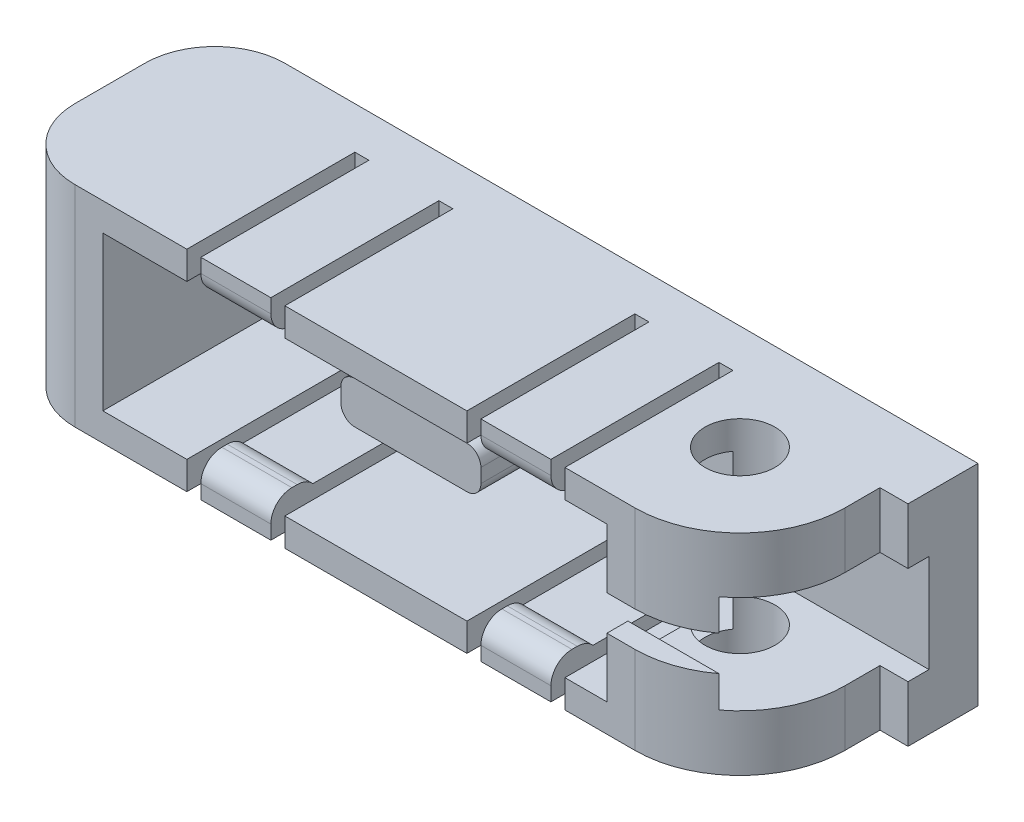
from build123d import *

# Parameters (mm, degrees)
SKETCH1_R             = 7.5
SKETCH1_R_2           = 2.5
SKETCH1_W             = 2
SKETCH1_H             = 5
BOSS_EXTRUDE1_DEPTH   = 7.5
CUT_EXTRUDE1_START    = 7.5
SKETCH2_W             = 36
SKETCH2_H             = 11
CUT_EXTRUDE1_DEPTH    = 12
SKETCH3_W             = 1.5
SKETCH3_H             = 2.5
SKETCH3_W_2           = 10
SKETCH3_H_2           = 7
CUT_EXTRUDE2_DEPTH    = 40
SKETCH5_W             = 1
SKETCH5_H             = 12
CUT_EXTRUDE3_DEPTH    = 20
BOSS_EXTRUDE2_START   = 14
SKETCH6_W             = 3
SKETCH6_H             = 0.5
BOSS_EXTRUDE2_DEPTH   = 5
FILLET2_R             = 1.5
LPATTERN4_START       = -12
LPATTERN4_OUTLINE_W   = 2
LPATTERN4_OUTLINE_H   = 12
LPATTERN4_DEPTH       = 1
LPATTERN4_START_2     = -6
LPATTERN4_2_OUTLINE_W = 2
LPATTERN4_2_OUTLINE_H = 12
LPATTERN4_2_DEPTH     = 1
LPATTERN4_START_3     = -11
LPATTERN4_3_DEPTH     = 5
LPATTERN4_4_DEPTH     = 5
BOSS_EXTRUDE3_START   = -4.5
BOSS_EXTRUDE3_DEPTH   = 8
SKETCH8_W             = 3
SKETCH8_H             = 4
CUT_EXTRUDE4_DEPTH    = 3


# Read off the part's stored shape, not the designer's step: LPattern4
with BuildPart() as part:
    # Sketch1 → Boss-Extrude1 (new, symmetric)
    # profile 1 of 4: a face of its own
    with BuildSketch(Plane(origin=(0, 0, 0), x_dir=(1, 0, 0), z_dir=(0, 1, 0))):
        with BuildLine():
            ThreePointArc((20, -7.5), (12.5, 0), (20, 7.5))
            Line((20, 7.5), (-20, 7.5))
            ThreePointArc((-20, 7.5), (-23.535533906, 6.035533906), (-25, 2.5))
            Line((-25, 2.5), (-25, -2.5))
            ThreePointArc((-25, -2.5), (-23.535533906, -6.035533906), (-20, -7.5))
            Line((-20, -7.5), (20, -7.5))
        make_face()
    # profile 2 of 4: a face of its own
    with BuildSketch(Plane(origin=(0, 0, 0), x_dir=(1, 0, 0), z_dir=(0, 1, 0))):
        with Locations((20, 0)):
            Circle(SKETCH1_R)
        with Locations(Location((20, 0, 0), (0, 0, 270))):
            Circle(SKETCH1_R_2, mode=Mode.SUBTRACT)
    # profile 3 of 4: a face of its own
    with BuildSketch(Plane(origin=(0, 0, 0), x_dir=(1, 0, 0), z_dir=(0, 1, 0))):
        with BuildLine():
            Line((27.5, 2.5), (27.5, 7.5))
            Line((27.5, 7.5), (20, 7.5))
            ThreePointArc((20, 7.5), (25.303300859, 5.303300859), (27.5, 0))
            Line((27.5, 0), (27.5, 2.5))
        make_face()
    # profile 4 of 4: a face of its own
    with BuildSketch(Plane(origin=(0, 0, 0), x_dir=(1, 0, 0), z_dir=(0, 1, 0))):
        with Locations((28.5, 5)):
            Rectangle(SKETCH1_W, SKETCH1_H)
    extrude(amount=BOSS_EXTRUDE1_DEPTH, both=True)

    # Sketch2 → Cut-Extrude1 (cut)
    with BuildSketch(Plane.XY.offset(CUT_EXTRUDE1_START)):
        Rectangle(SKETCH2_W, SKETCH2_H)
    extrude(amount=-CUT_EXTRUDE1_DEPTH, mode=Mode.SUBTRACT)

    # Sketch3 → Cut-Extrude2 (cut)
    with BuildSketch(Plane(origin=(0, 0, 0), x_dir=(0, 0, -1), z_dir=(1, 0, 0))):
        with Locations((-6.75, 0)):
            Rectangle(SKETCH3_W, SKETCH3_H)
        with Locations((-1, 0)):
            Rectangle(SKETCH3_W_2, SKETCH3_H_2)
    extrude(amount=CUT_EXTRUDE2_DEPTH, mode=Mode.SUBTRACT)

    # Sketch5 → Cut-Extrude3 (cut, symmetric)
    with BuildSketch(Plane(origin=(0, 0, 0), x_dir=(1, 0, 0), z_dir=(0, 1, 0))):
        with Locations((8.5, -1.5)):
            Rectangle(SKETCH5_W, SKETCH5_H)
        with Locations((14.5, -1.5)):
            Rectangle(SKETCH5_W, SKETCH5_H)
    extrude(amount=CUT_EXTRUDE3_DEPTH, both=True, mode=Mode.SUBTRACT)

    # Sketch6 → Boss-Extrude2 (add)
    with BuildSketch(Plane(origin=(0, 0, 0), x_dir=(0, 0, -1), z_dir=(1, 0, 0)).offset(BOSS_EXTRUDE2_START)):
        with Locations((-6, 5.25)):
            Rectangle(SKETCH6_W, SKETCH6_H)
        with Locations((-6, -5.25)):
            Rectangle(SKETCH6_W, SKETCH6_H)
    extrude(amount=-BOSS_EXTRUDE2_DEPTH)

    # Fillet2
    # the kernel refuses this fillet: 1.5 mm, written as the material it takes off along each edge
    with BuildSketch(Plane(origin=(16.795084972, 5, 4.5), x_dir=(0, 0, 1), z_dir=(-1, 0, 0))) as fillet2_piece_1:
        with BuildLine():
            CenterArc((1.118033989, 1.5), FILLET2_R, 221.810314896, 48.189685104)
            Line((0, 0.5), (0, 0))
            Line((0, 0), (1.118033989, 0))
        make_face()
    extrude(amount=10.590169944, mode=Mode.SUBTRACT)
    with BuildSketch(Plane(origin=(17.75, 5, 7.5), x_dir=(0, 1, 0), z_dir=(-1, 0, 0))) as fillet2_piece_2_section:
        with BuildLine():
            CenterArc((FILLET2_R, FILLET2_R), FILLET2_R, 180, 90)
            Line((0, FILLET2_R), (0, 0))
            Line((0, 0), (FILLET2_R, 0))
        make_face()
    fillet2_piece_2 = extrude(amount=12.5, mode=Mode.PRIVATE)
    fillet2_piece_2 = split(fillet2_piece_2, bisect_by=Plane(origin=(15, 5.743185978, 7.388433108), z_dir=(-1, 0, 0)), keep=Keep.TOP, mode=Mode.PRIVATE)
    fillet2_piece_2 = split(fillet2_piece_2, bisect_by=Plane(origin=(8, 5.743185978, 7.388433108), z_dir=(1, 0, 0)), keep=Keep.TOP, mode=Mode.PRIVATE)
    add(fillet2_piece_2, mode=Mode.SUBTRACT)
    with BuildSketch(Plane(origin=(16.795084972, -5, 4.5), x_dir=(0, 0, 1), z_dir=(-1, 0, 0))) as fillet2_piece_3:
        with BuildLine():
            CenterArc((1.118033989, -1.5), FILLET2_R, 90, 48.189685104)
            Line((0, -0.5), (0, 0))
            Line((0, 0), (1.118033989, 0))
        make_face()
    extrude(amount=10.590169944, mode=Mode.SUBTRACT)
    with BuildSketch(Plane(origin=(17.75, -5, 7.5), x_dir=(0, -1, 0), z_dir=(-1, 0, 0))) as fillet2_piece_4_section:
        with BuildLine():
            CenterArc((FILLET2_R, -FILLET2_R), FILLET2_R, 90, 90)
            Line((0, -FILLET2_R), (0, 0))
            Line((0, 0), (FILLET2_R, 0))
        make_face()
    fillet2_piece_4 = extrude(amount=8.75, mode=Mode.PRIVATE)
    fillet2_piece_4 = split(fillet2_piece_4, bisect_by=Plane(origin=(15, -5.743185978, 7.388433108), z_dir=(-1, 0, 0)), keep=Keep.TOP, mode=Mode.PRIVATE)
    add(fillet2_piece_4, mode=Mode.SUBTRACT)

    # LPattern4 outline → LPattern4 (cut)
    with BuildSketch(Plane.YZ.offset(LPATTERN4_START)):
        with Locations((-6.5, 1.5)):
            Rectangle(LPATTERN4_OUTLINE_W, LPATTERN4_OUTLINE_H)
        with Locations((6.5, 1.5)):
            Rectangle(LPATTERN4_OUTLINE_W, LPATTERN4_OUTLINE_H)
    extrude(amount=LPATTERN4_DEPTH, mode=Mode.SUBTRACT)

    # LPattern4 2 outline → LPattern4 2 (cut)
    with BuildSketch(Plane.YZ.offset(LPATTERN4_START_2)):
        with Locations((-6.5, 1.5)):
            Rectangle(LPATTERN4_2_OUTLINE_W, LPATTERN4_2_OUTLINE_H)
        with Locations((6.5, 1.5)):
            Rectangle(LPATTERN4_2_OUTLINE_W, LPATTERN4_2_OUTLINE_H)
    extrude(amount=LPATTERN4_2_DEPTH, mode=Mode.SUBTRACT)

    # LPattern4 3 outline → LPattern4 3 (cut)
    with BuildSketch(Plane.YZ.offset(LPATTERN4_START_3)):
        with BuildLine():
            ThreePointArc((-6.5, 7.5), (-5.964766865, 7.401258539), (-5.5, 7.118033989))
            Line((-5.5, 7.118033989), (-5.5, 7.5))
            Line((-5.5, 7.5), (-6.5, 7.5))
        make_face()
        with BuildLine():
            Line((6.5, 7.5), (5.5, 7.5))
            Line((5.5, 7.5), (5.5, 7.118033989))
            ThreePointArc((5.5, 7.118033989), (5.964766865, 7.401258539), (6.5, 7.5))
        make_face()
    extrude(amount=LPATTERN4_3_DEPTH, mode=Mode.SUBTRACT)

    # LPattern4 4 outline → LPattern4 4 (add)
    with BuildSketch(Plane.YZ.offset(LPATTERN4_START_3)):
        with BuildLine():
            Line((-5, 5.618033989), (-5, 6))
            ThreePointArc((-5, 6), (-5.130693606, 6.612372436), (-5.5, 7.118033989))
            Line((-5.5, 7.118033989), (-5.5, 4.5))
            ThreePointArc((-5.5, 4.5), (-5.130693606, 5.005661553), (-5, 5.618033989))
        make_face()
        with BuildLine():
            Line((5.5, 4.5), (5.5, 7.118033989))
            ThreePointArc((5.5, 7.118033989), (5.130693606, 6.612372436), (5, 6))
            Line((5, 6), (5, 5.618033989))
            ThreePointArc((5, 5.618033989), (5.130693606, 5.005661553), (5.5, 4.5))
        make_face()
    extrude(amount=LPATTERN4_4_DEPTH)

    # Sketch7 → Boss-Extrude3 (add)
    with BuildSketch(Plane.XY.offset(BOSS_EXTRUDE3_START)):
        with BuildLine():
            Line((4, -1.5), (-4, -1.5))
            ThreePointArc((-4, -1.5), (-4.707106781, -1.207106781), (-5, -0.5))
            Line((-5, -0.5), (-5, 0.5))
            ThreePointArc((-5, 0.5), (-4.707106781, 1.207106781), (-4, 1.5))
            Line((-4, 1.5), (4, 1.5))
            ThreePointArc((4, 1.5), (4.707106781, 1.207106781), (5, 0.5))
            Line((5, 0.5), (5, -0.5))
            ThreePointArc((5, -0.5), (4.707106781, -1.207106781), (4, -1.5))
        make_face()
    extrude(amount=BOSS_EXTRUDE3_DEPTH)

    # Sketch8 → Cut-Extrude4 (cut)
    with BuildSketch(Plane.ZY.offset(5)):
        Rectangle(SKETCH8_W, SKETCH8_H)
    extrude(amount=-CUT_EXTRUDE4_DEPTH, mode=Mode.SUBTRACT)


solid = part.part
